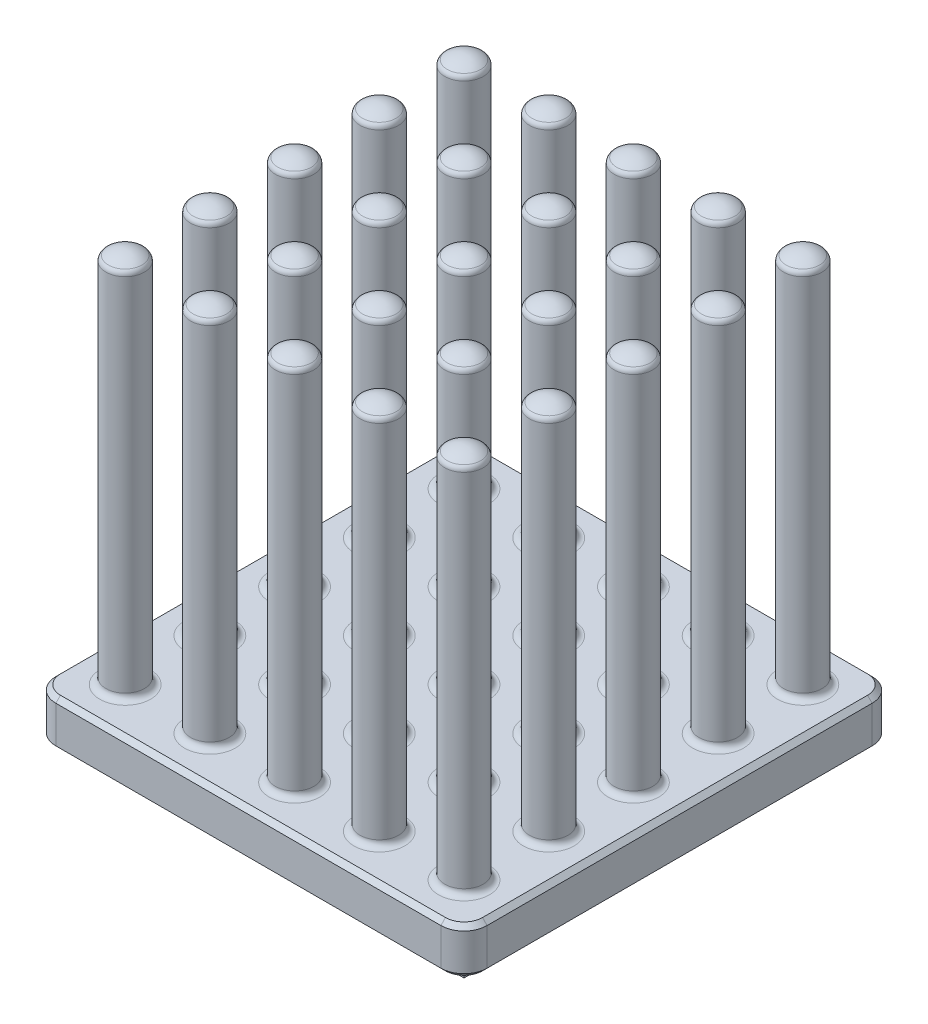
from build123d import *

# Parameters (mm, degrees)
BOSS_EXTRU_1_DEPTH                   = 1.5
CONG_1_R                             = 0.75
CHANFREIN1_SIZE                      = 0.15
ESQUISSE3_R                          = 0.625
BOSS_EXTRU_2_DEPTH                   = 12
CONG_2_R                             = 0.2
R_P_TITION_LIN_AIRE1_COUNT           = 3
R_P_TITION_LIN_AIRE1_PITCH           = 2.75
CONG_2_OF_R_P_TITION_LIN_AIRE1_R     = 0.2
R_P_TITION_LIN_AIRE1_COL_COUNT       = 3
R_P_TITION_LIN_AIRE1_COL_PITCH       = 2.75
CONG_2_OF_R_P_TITION_LIN_AIRE1_COL_R = 0.2
BOSS_EXTRU_3_DEPTH                   = 0.25


# Read off the part's stored shape, not the designer's step: Répétition linéaire2
with BuildPart() as part:
    # Esquisse1 → Boss.-Extru.1 (new body)
    with BuildSketch(Plane(origin=(0, 0, 0), x_dir=(1, 0, 0), z_dir=(0, 1, 0))):
        Polygon((-6.999999999999999, 6.999999999999999), (6.999999999999999, 6.999999999999999), (7.000000000000003, -6.999999999999999), (-6.999999999999996, -6.999999999999999), align=None)
    extrude(amount=BOSS_EXTRU_1_DEPTH)

    # Congé1
    cong_1_edges = [part.edges().sort_by_distance(p)[0] for p in [
        (7.000000000000003, 0.75, 6.999999999999999),
        (-6.999999999999996, 0.75, 6.999999999999999),
        (-6.999999999999999, 0.75, -6.999999999999999),
        (6.999999999999999, 0.75, -6.999999999999999),
    ]]
    fillet(cong_1_edges, radius=CONG_1_R)

    # Chanfrein1
    chanfrein1_edges = [part.edges().sort_by_distance(p)[0] for p in [
        (3.55e-15, 0, 6.999999999999999),
        (3.55e-15, 1.5, 6.999999999999999),
        (7.000000000000001, 0, 0),
        (-6.999999999999997, 0, 0),
        (0, 0, -6.999999999999999),
        (6.780330085889913, 0, 6.78033008588991),
        (6.78033008588991, 0, -6.78033008588991),
        (-6.78033008588991, 0, -6.78033008588991),
        (-6.780330085889906, 0, 6.78033008588991),
        (-6.999999999999997, 1.5, 0),
        (7.000000000000001, 1.5, 0),
        (0, 1.5, -6.999999999999999),
        (6.780330085889913, 1.5, 6.78033008588991),
        (6.78033008588991, 1.5, -6.78033008588991),
        (-6.78033008588991, 1.5, -6.78033008588991),
        (-6.780330085889906, 1.5, 6.78033008588991),
    ]]
    chamfer(chanfrein1_edges, length=CHANFREIN1_SIZE)

    # Esquisse3 → Boss.-Extru.2 (add)
    with BuildSketch(Plane(origin=(0, 1.5, 0), x_dir=(1, 0, 0), z_dir=(0, 1, 0))):
        with Locations(Location((0, 0, 0), (0, 0, 270))):
            Circle(ESQUISSE3_R)
    boss_extru_2 = extrude(amount=BOSS_EXTRU_2_DEPTH)

    # Esquisse4 → Révolution1 (revolve)
    with BuildSketch(Plane.XY):
        with BuildLine():
            Line((0, 13.5), (0, 13.75))
            ThreePointArc((0, 13.75), (0.3365728004459065, 13.685182001114766), (0.625, 13.5))
            Line((0.625, 13.5), (0, 13.5))
        make_face()
    r_volution1 = revolve(axis=Axis((0, 13.5, 0), (0, 1, 0)))

    # Congé2
    cong_2_edges = [part.edges().sort_by_distance(p)[0] for p in [
        (1.9e-16, 1.5, -0.625),
        (-0.4419417382415921, 13.5, -0.4419417382415924),
    ]]
    fillet(cong_2_edges, radius=CONG_2_R)

    # Répétition linéaire1: Boss.-Extru.2, Révolution1 ×3
    with Locations(*[(0, 0, -i * R_P_TITION_LIN_AIRE1_PITCH) for i in range(1, R_P_TITION_LIN_AIRE1_COUNT)]):
        add(boss_extru_2)
        add(r_volution1)

    # Congé2 of Répétition linéaire1
    cong_2_of_r_p_tition_lin_aire1_edges = [part.edges().sort_by_distance(p)[0] for p in [
        (-5.7e-16, 1.5, -3.375),
        (-0.4419417382415929, 13.5, -3.191941738241592),
        (-1.34e-15, 1.5, -6.125),
        (-0.44194173824159366, 13.5, -5.941941738241592),
    ]]
    fillet(cong_2_of_r_p_tition_lin_aire1_edges, radius=CONG_2_OF_R_P_TITION_LIN_AIRE1_R)

    # Répétition linéaire1 col: Boss.-Extru.2, Révolution1 ×3
    with Locations(*[(0, 0, i * R_P_TITION_LIN_AIRE1_COL_PITCH) for i in range(1, R_P_TITION_LIN_AIRE1_COL_COUNT)]):
        add(boss_extru_2)
        add(r_volution1)

    # Congé2 of Répétition linéaire1 col
    cong_2_of_r_p_tition_lin_aire1_col_edges = [part.edges().sort_by_distance(p)[0] for p in [
        (9.5e-16, 1.5, 2.125),
        (-0.44194173824159133, 13.5, 2.308058261758408),
        (1.72e-15, 1.5, 4.875),
        (-0.44194173824159055, 13.5, 5.058058261758408),
    ]]
    fillet(cong_2_of_r_p_tition_lin_aire1_col_edges, radius=CONG_2_OF_R_P_TITION_LIN_AIRE1_COL_R)

    # Répétition linéaire2 outline → Répétition linéaire2 (revolve)
    with BuildSketch(Plane(origin=(2.75, 0, -2.75), x_dir=(1, 0, 0), z_dir=(0, 0, 1))):
        with BuildLine():
            Line((0, 1.5), (0.825, 1.5))
            ThreePointArc((0.825, 1.5), (0.683578644, 1.558578644), (0.625, 1.7))
            Line((0.625, 1.7), (0.625, 13.407810336))
            ThreePointArc((0.625, 13.407810336), (0.603984352, 13.497054953), (0.545353982, 13.567544236))
            ThreePointArc((0.545353982, 13.567544236), (0.287533073, 13.703176433), (0, 13.75))
            Line((0, 13.75), (0, 1.5))
        make_face()
    revolve(axis=Axis((2.75, 0, -2.75), (0, 1, 0)))

    # R_p_tition lin_aire2 2 outline → R_p_tition lin_aire2 2 (revolve)
    with BuildSketch(Plane(origin=(5.5, 0, -2.75), x_dir=(1, 0, 0), z_dir=(0, 0, 1))):
        with BuildLine():
            Line((0, 1.5), (0.825, 1.5))
            ThreePointArc((0.825, 1.5), (0.683578644, 1.558578644), (0.625, 1.7))
            Line((0.625, 1.7), (0.625, 13.407810336))
            ThreePointArc((0.625, 13.407810336), (0.603984352, 13.497054953), (0.545353982, 13.567544236))
            ThreePointArc((0.545353982, 13.567544236), (0.287533073, 13.703176433), (0, 13.75))
            Line((0, 13.75), (0, 1.5))
        make_face()
    revolve(axis=Axis((5.5, 0, -2.75), (0, 1, 0)))

    # R_p_tition lin_aire2 3 outline → R_p_tition lin_aire2 3 (revolve)
    with BuildSketch(Plane(origin=(-2.75, 0, -2.75), x_dir=(1, 0, 0), z_dir=(0, 0, 1))):
        with BuildLine():
            Line((0, 1.5), (0.825, 1.5))
            ThreePointArc((0.825, 1.5), (0.683578644, 1.558578644), (0.625, 1.7))
            Line((0.625, 1.7), (0.625, 13.407810336))
            ThreePointArc((0.625, 13.407810336), (0.603984352, 13.497054953), (0.545353982, 13.567544236))
            ThreePointArc((0.545353982, 13.567544236), (0.287533073, 13.703176433), (0, 13.75))
            Line((0, 13.75), (0, 1.5))
        make_face()
    revolve(axis=Axis((-2.75, 0, -2.75), (0, 1, 0)))

    # R_p_tition lin_aire2 4 outline → R_p_tition lin_aire2 4 (revolve)
    with BuildSketch(Plane(origin=(-5.5, 0, -2.75), x_dir=(1, 0, 0), z_dir=(0, 0, 1))):
        with BuildLine():
            Line((0, 1.5), (0.825, 1.5))
            ThreePointArc((0.825, 1.5), (0.683578644, 1.558578644), (0.625, 1.7))
            Line((0.625, 1.7), (0.625, 13.407810336))
            ThreePointArc((0.625, 13.407810336), (0.603984352, 13.497054953), (0.545353982, 13.567544236))
            ThreePointArc((0.545353982, 13.567544236), (0.287533073, 13.703176433), (0, 13.75))
            Line((0, 13.75), (0, 1.5))
        make_face()
    revolve(axis=Axis((-5.5, 0, -2.75), (0, 1, 0)))

    # R_p_tition lin_aire2 5 outline → R_p_tition lin_aire2 5 (revolve)
    with BuildSketch(Plane(origin=(2.75, 0, 0), x_dir=(1, 0, 0), z_dir=(0, 0, 1))):
        with BuildLine():
            Line((0, 1.5), (0.825, 1.5))
            ThreePointArc((0.825, 1.5), (0.683578644, 1.558578644), (0.625, 1.7))
            Line((0.625, 1.7), (0.625, 13.407810336))
            ThreePointArc((0.625, 13.407810336), (0.603984352, 13.497054953), (0.545353982, 13.567544236))
            ThreePointArc((0.545353982, 13.567544236), (0.287533073, 13.703176433), (0, 13.75))
            Line((0, 13.75), (0, 1.5))
        make_face()
    revolve(axis=Axis((2.75, 0, 0), (0, 1, 0)))

    # R_p_tition lin_aire2 6 outline → R_p_tition lin_aire2 6 (revolve)
    with BuildSketch(Plane(origin=(5.5, 0, 0), x_dir=(1, 0, 0), z_dir=(0, 0, 1))):
        with BuildLine():
            Line((0, 1.5), (0.825, 1.5))
            ThreePointArc((0.825, 1.5), (0.683578644, 1.558578644), (0.625, 1.7))
            Line((0.625, 1.7), (0.625, 13.407810336))
            ThreePointArc((0.625, 13.407810336), (0.603984352, 13.497054953), (0.545353982, 13.567544236))
            ThreePointArc((0.545353982, 13.567544236), (0.287533073, 13.703176433), (0, 13.75))
            Line((0, 13.75), (0, 1.5))
        make_face()
    revolve(axis=Axis((5.5, 0, 0), (0, 1, 0)))

    # R_p_tition lin_aire2 7 outline → R_p_tition lin_aire2 7 (revolve)
    with BuildSketch(Plane(origin=(-2.75, 0, 0), x_dir=(1, 0, 0), z_dir=(0, 0, 1))):
        with BuildLine():
            Line((0, 1.5), (0.825, 1.5))
            ThreePointArc((0.825, 1.5), (0.683578644, 1.558578644), (0.625, 1.7))
            Line((0.625, 1.7), (0.625, 13.407810336))
            ThreePointArc((0.625, 13.407810336), (0.603984352, 13.497054953), (0.545353982, 13.567544236))
            ThreePointArc((0.545353982, 13.567544236), (0.287533073, 13.703176433), (0, 13.75))
            Line((0, 13.75), (0, 1.5))
        make_face()
    revolve(axis=Axis((-2.75, 0, 0), (0, 1, 0)))

    # R_p_tition lin_aire2 8 outline → R_p_tition lin_aire2 8 (revolve)
    with BuildSketch(Plane(origin=(-5.5, 0, 0), x_dir=(1, 0, 0), z_dir=(0, 0, 1))):
        with BuildLine():
            Line((0, 1.5), (0.825, 1.5))
            ThreePointArc((0.825, 1.5), (0.683578644, 1.558578644), (0.625, 1.7))
            Line((0.625, 1.7), (0.625, 13.407810336))
            ThreePointArc((0.625, 13.407810336), (0.603984352, 13.497054953), (0.545353982, 13.567544236))
            ThreePointArc((0.545353982, 13.567544236), (0.287533073, 13.703176433), (0, 13.75))
            Line((0, 13.75), (0, 1.5))
        make_face()
    revolve(axis=Axis((-5.5, 0, 0), (0, 1, 0)))

    # R_p_tition lin_aire2 9 outline → R_p_tition lin_aire2 9 (revolve)
    with BuildSketch(Plane(origin=(2.75, 0, 5.5), x_dir=(1, 0, 0), z_dir=(0, 0, 1))):
        with BuildLine():
            Line((0, 1.5), (0.825, 1.5))
            ThreePointArc((0.825, 1.5), (0.683578644, 1.558578644), (0.625, 1.7))
            Line((0.625, 1.7), (0.625, 13.407810336))
            ThreePointArc((0.625, 13.407810336), (0.603984352, 13.497054953), (0.545353982, 13.567544236))
            ThreePointArc((0.545353982, 13.567544236), (0.287533073, 13.703176433), (0, 13.75))
            Line((0, 13.75), (0, 1.5))
        make_face()
    revolve(axis=Axis((2.75, 0, 5.5), (0, 1, 0)))

    # R_p_tition lin_aire2 10 outline → R_p_tition lin_aire2 10 (revolve)
    with BuildSketch(Plane(origin=(5.5, 0, 5.5), x_dir=(1, 0, 0), z_dir=(0, 0, 1))):
        with BuildLine():
            Line((0, 1.5), (0.825, 1.5))
            ThreePointArc((0.825, 1.5), (0.683578644, 1.558578644), (0.625, 1.7))
            Line((0.625, 1.7), (0.625, 13.407810336))
            ThreePointArc((0.625, 13.407810336), (0.603984352, 13.497054953), (0.545353982, 13.567544236))
            ThreePointArc((0.545353982, 13.567544236), (0.287533073, 13.703176433), (0, 13.75))
            Line((0, 13.75), (0, 1.5))
        make_face()
    revolve(axis=Axis((5.5, 0, 5.5), (0, 1, 0)))

    # R_p_tition lin_aire2 11 outline → R_p_tition lin_aire2 11 (revolve)
    with BuildSketch(Plane(origin=(-2.75, 0, 5.5), x_dir=(1, 0, 0), z_dir=(0, 0, 1))):
        with BuildLine():
            Line((0, 1.5), (0.825, 1.5))
            ThreePointArc((0.825, 1.5), (0.683578644, 1.558578644), (0.625, 1.7))
            Line((0.625, 1.7), (0.625, 13.407810336))
            ThreePointArc((0.625, 13.407810336), (0.603984352, 13.497054953), (0.545353982, 13.567544236))
            ThreePointArc((0.545353982, 13.567544236), (0.287533073, 13.703176433), (0, 13.75))
            Line((0, 13.75), (0, 1.5))
        make_face()
    revolve(axis=Axis((-2.75, 0, 5.5), (0, 1, 0)))

    # R_p_tition lin_aire2 12 outline → R_p_tition lin_aire2 12 (revolve)
    with BuildSketch(Plane(origin=(-5.5, 0, 5.5), x_dir=(1, 0, 0), z_dir=(0, 0, 1))):
        with BuildLine():
            Line((0, 1.5), (0.825, 1.5))
            ThreePointArc((0.825, 1.5), (0.683578644, 1.558578644), (0.625, 1.7))
            Line((0.625, 1.7), (0.625, 13.407810336))
            ThreePointArc((0.625, 13.407810336), (0.603984352, 13.497054953), (0.545353982, 13.567544236))
            ThreePointArc((0.545353982, 13.567544236), (0.287533073, 13.703176433), (0, 13.75))
            Line((0, 13.75), (0, 1.5))
        make_face()
    revolve(axis=Axis((-5.5, 0, 5.5), (0, 1, 0)))

    # R_p_tition lin_aire2 13 outline → R_p_tition lin_aire2 13 (revolve)
    with BuildSketch(Plane(origin=(2.75, 0, 2.75), x_dir=(1, 0, 0), z_dir=(0, 0, 1))):
        with BuildLine():
            Line((0, 1.5), (0.825, 1.5))
            ThreePointArc((0.825, 1.5), (0.683578644, 1.558578644), (0.625, 1.7))
            Line((0.625, 1.7), (0.625, 13.407810336))
            ThreePointArc((0.625, 13.407810336), (0.603984352, 13.497054953), (0.545353982, 13.567544236))
            ThreePointArc((0.545353982, 13.567544236), (0.287533073, 13.703176433), (0, 13.75))
            Line((0, 13.75), (0, 1.5))
        make_face()
    revolve(axis=Axis((2.75, 0, 2.75), (0, 1, 0)))

    # R_p_tition lin_aire2 14 outline → R_p_tition lin_aire2 14 (revolve)
    with BuildSketch(Plane(origin=(5.5, 0, 2.75), x_dir=(1, 0, 0), z_dir=(0, 0, 1))):
        with BuildLine():
            Line((0, 1.5), (0.825, 1.5))
            ThreePointArc((0.825, 1.5), (0.683578644, 1.558578644), (0.625, 1.7))
            Line((0.625, 1.7), (0.625, 13.407810336))
            ThreePointArc((0.625, 13.407810336), (0.603984352, 13.497054953), (0.545353982, 13.567544236))
            ThreePointArc((0.545353982, 13.567544236), (0.287533073, 13.703176433), (0, 13.75))
            Line((0, 13.75), (0, 1.5))
        make_face()
    revolve(axis=Axis((5.5, 0, 2.75), (0, 1, 0)))

    # R_p_tition lin_aire2 15 outline → R_p_tition lin_aire2 15 (revolve)
    with BuildSketch(Plane(origin=(-2.75, 0, 2.75), x_dir=(1, 0, 0), z_dir=(0, 0, 1))):
        with BuildLine():
            Line((0, 1.5), (0.825, 1.5))
            ThreePointArc((0.825, 1.5), (0.683578644, 1.558578644), (0.625, 1.7))
            Line((0.625, 1.7), (0.625, 13.407810336))
            ThreePointArc((0.625, 13.407810336), (0.603984352, 13.497054953), (0.545353982, 13.567544236))
            ThreePointArc((0.545353982, 13.567544236), (0.287533073, 13.703176433), (0, 13.75))
            Line((0, 13.75), (0, 1.5))
        make_face()
    revolve(axis=Axis((-2.75, 0, 2.75), (0, 1, 0)))

    # R_p_tition lin_aire2 16 outline → R_p_tition lin_aire2 16 (revolve)
    with BuildSketch(Plane(origin=(-5.5, 0, 2.75), x_dir=(1, 0, 0), z_dir=(0, 0, 1))):
        with BuildLine():
            Line((0, 1.5), (0.825, 1.5))
            ThreePointArc((0.825, 1.5), (0.683578644, 1.558578644), (0.625, 1.7))
            Line((0.625, 1.7), (0.625, 13.407810336))
            ThreePointArc((0.625, 13.407810336), (0.603984352, 13.497054953), (0.545353982, 13.567544236))
            ThreePointArc((0.545353982, 13.567544236), (0.287533073, 13.703176433), (0, 13.75))
            Line((0, 13.75), (0, 1.5))
        make_face()
    revolve(axis=Axis((-5.5, 0, 2.75), (0, 1, 0)))

    # R_p_tition lin_aire2 17 outline → R_p_tition lin_aire2 17 (revolve)
    with BuildSketch(Plane(origin=(2.75, 0, -5.5), x_dir=(1, 0, 0), z_dir=(0, 0, 1))):
        with BuildLine():
            Line((0, 1.5), (0.825, 1.5))
            ThreePointArc((0.825, 1.5), (0.683578644, 1.558578644), (0.625, 1.7))
            Line((0.625, 1.7), (0.625, 13.407810336))
            ThreePointArc((0.625, 13.407810336), (0.603984352, 13.497054953), (0.545353982, 13.567544236))
            ThreePointArc((0.545353982, 13.567544236), (0.287533073, 13.703176433), (0, 13.75))
            Line((0, 13.75), (0, 1.5))
        make_face()
    revolve(axis=Axis((2.75, 0, -5.5), (0, 1, 0)))

    # R_p_tition lin_aire2 18 outline → R_p_tition lin_aire2 18 (revolve)
    with BuildSketch(Plane(origin=(5.5, 0, -5.5), x_dir=(1, 0, 0), z_dir=(0, 0, 1))):
        with BuildLine():
            Line((0, 1.5), (0.825, 1.5))
            ThreePointArc((0.825, 1.5), (0.683578644, 1.558578644), (0.625, 1.7))
            Line((0.625, 1.7), (0.625, 13.407810336))
            ThreePointArc((0.625, 13.407810336), (0.603984352, 13.497054953), (0.545353982, 13.567544236))
            ThreePointArc((0.545353982, 13.567544236), (0.287533073, 13.703176433), (0, 13.75))
            Line((0, 13.75), (0, 1.5))
        make_face()
    revolve(axis=Axis((5.5, 0, -5.5), (0, 1, 0)))

    # R_p_tition lin_aire2 19 outline → R_p_tition lin_aire2 19 (revolve)
    with BuildSketch(Plane(origin=(-2.75, 0, -5.5), x_dir=(1, 0, 0), z_dir=(0, 0, 1))):
        with BuildLine():
            Line((0, 1.5), (0.825, 1.5))
            ThreePointArc((0.825, 1.5), (0.683578644, 1.558578644), (0.625, 1.7))
            Line((0.625, 1.7), (0.625, 13.407810336))
            ThreePointArc((0.625, 13.407810336), (0.603984352, 13.497054953), (0.545353982, 13.567544236))
            ThreePointArc((0.545353982, 13.567544236), (0.287533073, 13.703176433), (0, 13.75))
            Line((0, 13.75), (0, 1.5))
        make_face()
    revolve(axis=Axis((-2.75, 0, -5.5), (0, 1, 0)))

    # R_p_tition lin_aire2 20 outline → R_p_tition lin_aire2 20 (revolve)
    with BuildSketch(Plane(origin=(-5.5, 0, -5.5), x_dir=(1, 0, 0), z_dir=(0, 0, 1))):
        with BuildLine():
            Line((0, 1.5), (0.825, 1.5))
            ThreePointArc((0.825, 1.5), (0.683578644, 1.558578644), (0.625, 1.7))
            Line((0.625, 1.7), (0.625, 13.407810336))
            ThreePointArc((0.625, 13.407810336), (0.603984352, 13.497054953), (0.545353982, 13.567544236))
            ThreePointArc((0.545353982, 13.567544236), (0.287533073, 13.703176433), (0, 13.75))
            Line((0, 13.75), (0, 1.5))
        make_face()
    revolve(axis=Axis((-5.5, 0, -5.5), (0, 1, 0)))


with BuildPart() as body_2:
    # Esquisse5 → Boss.-Extru.3 (new body)
    with BuildSketch(Plane.XZ):
        Polygon((-6.499999999999996, 6.499999999999999), (-6.499999999999999, -6.499999999999999), (6.499999999999999, -6.499999999999999), (6.500000000000003, 6.499999999999999), align=None)
    extrude(amount=BOSS_EXTRU_3_DEPTH)


solid = Compound([part.part, body_2.part])
